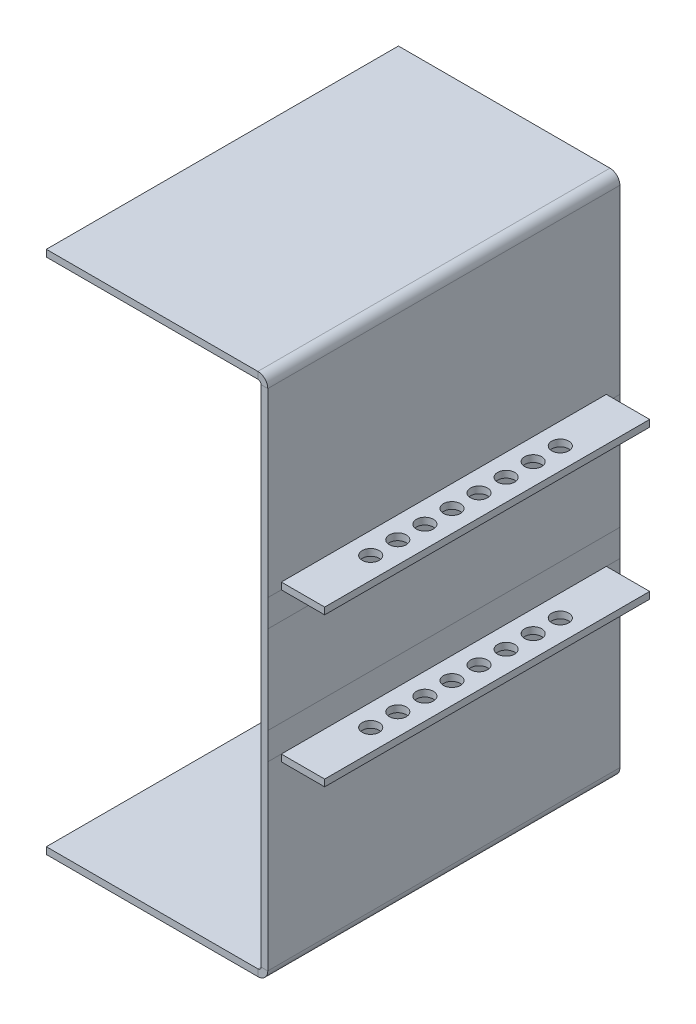
from build123d import *

# Parameters (mm, degrees)
SKETCH1_W              = 82.55
SKETCH1_H              = 222.25
BASE_FLANGE1_DEPTH     = 1.5875
SKETCHED_START         = -41.275
SKETCHED_BEND1_DEPTH   = 82.55
SKETCHED_BEND1_2_DEPTH = 82.55
SKETCH8_W              = 76.2
SKETCH8_H              = 1.5875
BOSS_EXTRUDE1_DEPTH    = 10.16
BOSS_EXTRUDE1_2_DEPTH  = 10.16
CUT_EXTRUDE1_START     = -36.5125
SKETCH11_R             = 2
CUT_EXTRUDE1_DEPTH     = 36.5125


# Read off the part's stored shape, not the designer's step: Sketched Bend1
# Sheet-metal steps are written as plain solids
with BuildPart() as part:
    # Sketch1 → Base-Flange1 (new body)
    with BuildSketch(Plane(origin=(0, 0, 0), x_dir=(0, 0, -1), z_dir=(1, 0, 0))):
        Rectangle(SKETCH1_W, SKETCH1_H)
    extrude(amount=BASE_FLANGE1_DEPTH)

    # Sketched Bend1 outline → Sketched Bend1 (cut)
    with BuildSketch(Plane.XY.offset(SKETCHED_START)):
        with BuildLine():
            ThreePointArc((0, 61.3273484), (1.149317929, 60.481283273), (1.5875, 59.123065921))
            Line((1.5875, 59.123065921), (1.5875, 111.125))
            Line((1.5875, 111.125), (0, 111.125))
            Line((0, 111.125), (0, 61.3273484))
        make_face()
        with BuildLine():
            Line((1.5875, -111.125), (1.5875, -59.123065921))
            ThreePointArc((1.5875, -59.123065921), (1.149317929, -60.481283273), (0, -61.3273484))
            Line((0, -61.3273484), (0, -111.125))
            Line((0, -111.125), (1.5875, -111.125))
        make_face()
    extrude(amount=SKETCHED_BEND1_DEPTH, mode=Mode.SUBTRACT)

    # Sketched Bend1 2 outline → Sketched Bend1 2 (add)
    with BuildSketch(Plane.XY.offset(SKETCHED_START)):
        with BuildLine():
            Line((0, 59.123065921), (0, 61.3273484))
            ThreePointArc((0, 61.3273484), (-0.363459343, 61.417015977), (-0.7366, 61.447165921))
            Line((-0.7366, 61.447165921), (-50.334665921, 61.447165921))
            Line((-50.334665921, 61.447165921), (-50.334665921, 59.859665921))
            Line((-50.334665921, 59.859665921), (-0.7366, 59.859665921))
            ThreePointArc((-0.7366, 59.859665921), (-0.215745145, 59.643920776), (0, 59.123065921))
        make_face()
        with BuildLine():
            ThreePointArc((-0.7366, -61.447165921), (-0.363459343, -61.417015977), (0, -61.3273484))
            Line((0, -61.3273484), (0, -59.123065921))
            ThreePointArc((0, -59.123065921), (-0.215745145, -59.643920776), (-0.7366, -59.859665921))
            Line((-0.7366, -59.859665921), (-50.334665921, -59.859665921))
            Line((-50.334665921, -59.859665921), (-50.334665921, -61.447165921))
            Line((-50.334665921, -61.447165921), (-0.7366, -61.447165921))
        make_face()
    extrude(amount=SKETCHED_BEND1_2_DEPTH)


with BuildPart() as body_2:
    # Sketch8 → Boss-Extrude1 (new body)
    with BuildSketch(Plane(origin=(1.5875, 0, 0), x_dir=(0, 0, -1), z_dir=(1, 0, 0))):
        with Locations((0, -17.4625)):
            Rectangle(SKETCH8_W, SKETCH8_H)
    extrude(amount=BOSS_EXTRUDE1_DEPTH)


with BuildPart() as body_3:
    # Sketch8 → Boss-Extrude1 2 (new body)
    with BuildSketch(Plane(origin=(1.5875, 0, 0), x_dir=(0, 0, -1), z_dir=(1, 0, 0))):
        with Locations((0, 17.4625)):
            Rectangle(SKETCH8_W, SKETCH8_H)
    extrude(amount=BOSS_EXTRUDE1_2_DEPTH)


with BuildPart() as cut_extrude1_tool:
    # Sketch11 → Cut-Extrude1 (new body)
    with BuildSketch(Plane.XZ.offset(18.25625).offset(CUT_EXTRUDE1_START)):
        with Locations(Location((6.6675, 3.175, 0), (0, 0, 270))):
            Circle(SKETCH11_R)
        with Locations(Location((6.6675, -3.175, 0), (0, 0, 270))):
            Circle(SKETCH11_R)
        with Locations(Location((6.6675, 9.525, 0), (0, 0, 270))):
            Circle(SKETCH11_R)
        with Locations(Location((6.6675, 15.875, 0), (0, 0, 270))):
            Circle(SKETCH11_R)
        with Locations(Location((6.6675, 22.225, 0), (0, 0, 270))):
            Circle(SKETCH11_R)
        with Locations(Location((6.6675, -9.525, 0), (0, 0, 270))):
            Circle(SKETCH11_R)
        with Locations(Location((6.6675, -15.875, 0), (0, 0, 270))):
            Circle(SKETCH11_R)
        with Locations(Location((6.6675, -22.225, 0), (0, 0, 270))):
            Circle(SKETCH11_R)
    extrude(amount=CUT_EXTRUDE1_DEPTH)


with BuildPart() as body_2_1:
    add(body_2.part)

    # Cut-Extrude1: cut by cut_extrude1_tool
    add(cut_extrude1_tool.part, mode=Mode.SUBTRACT)


with BuildPart() as body_3_1:
    add(body_3.part)

    # Cut-Extrude1: cut by cut_extrude1_tool
    add(cut_extrude1_tool.part, mode=Mode.SUBTRACT)


solid = Compound([part.part, body_2_1.part, body_3_1.part])
